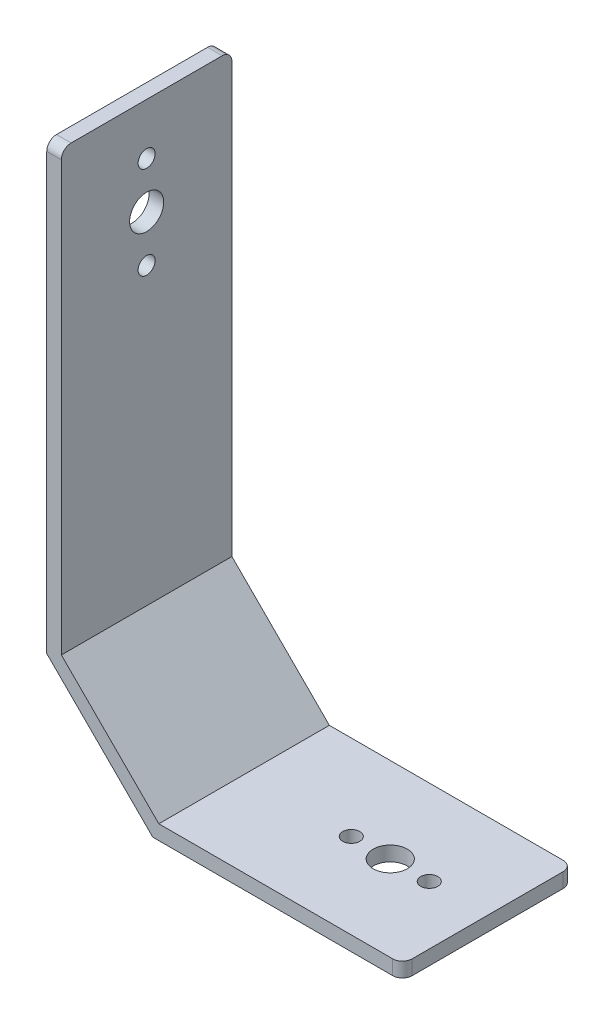
from build123d import *

# Parameters (mm, degrees)
EXTRU_MINCE1_DEPTH      = 35
ESQUISSE2_R             = 1.75
ESQUISSE2_R_2           = 3.5
ENL_V_MAT_EXTRU_1_DEPTH = 3
CONG_3_R                = 2
CONG_4_R                = 2
CONG_5_R                = 2
CONG_6_R                = 2
ESQUISSE3_R             = 1.75
ESQUISSE3_R_2           = 3.5
ENL_V_MAT_EXTRU_2_DEPTH = 10


with BuildPart() as part:
    # Esquisse1 → Extru.-Mince1 (new body)
    with BuildSketch(Plane.XY):
        Polygon((70, -20), (20, -20), (0, 0), (0, 90), (-3, 90), (-3, -1.242640687), (18.757359313, -23), (70, -23), align=None)
    extrude(amount=EXTRU_MINCE1_DEPTH)

    # Esquisse2 → Enlèv. mat.-Extru.1 (cut)
    with BuildSketch(Plane(origin=(0, 0, 0), x_dir=(0, 0, -1), z_dir=(1, 0, 0))):
        with Locations((-17.5, 79.5)):
            Circle(ESQUISSE2_R)
        with Locations((-17.5, 60.5)):
            Circle(ESQUISSE2_R)
        with Locations((-17.5, 70)):
            Circle(ESQUISSE2_R_2)
    extrude(amount=-ENL_V_MAT_EXTRU_1_DEPTH, mode=Mode.SUBTRACT)

    # Congé3
    cong_3_edges = [part.edges().sort_by_distance(p)[0] for p in [
        (-1.5, 90, 35),
    ]]
    fillet(cong_3_edges, radius=CONG_3_R)

    # Congé4
    cong_4_edges = [part.edges().sort_by_distance(p)[0] for p in [
        (-1.5, 90, 0),
    ]]
    fillet(cong_4_edges, radius=CONG_4_R)

    # Congé5
    cong_5_edges = [part.edges().sort_by_distance(p)[0] for p in [
        (70, -21.5, 35),
    ]]
    fillet(cong_5_edges, radius=CONG_5_R)

    # Congé6
    cong_6_edges = [part.edges().sort_by_distance(p)[0] for p in [
        (70, -21.5, 0),
    ]]
    fillet(cong_6_edges, radius=CONG_6_R)

    # Esquisse3 → Enlèv. mat.-Extru.2 (cut)
    with BuildSketch(Plane(origin=(0, -20, 0), x_dir=(1, 0, 0), z_dir=(0, 1, 0))):
        with Locations((58, -17.5)):
            Circle(ESQUISSE3_R)
        with Locations((42, -17.5)):
            Circle(ESQUISSE3_R)
        with Locations((50, -17.5)):
            Circle(ESQUISSE3_R_2)
    extrude(amount=-ENL_V_MAT_EXTRU_2_DEPTH, mode=Mode.SUBTRACT)


solid = part.part
